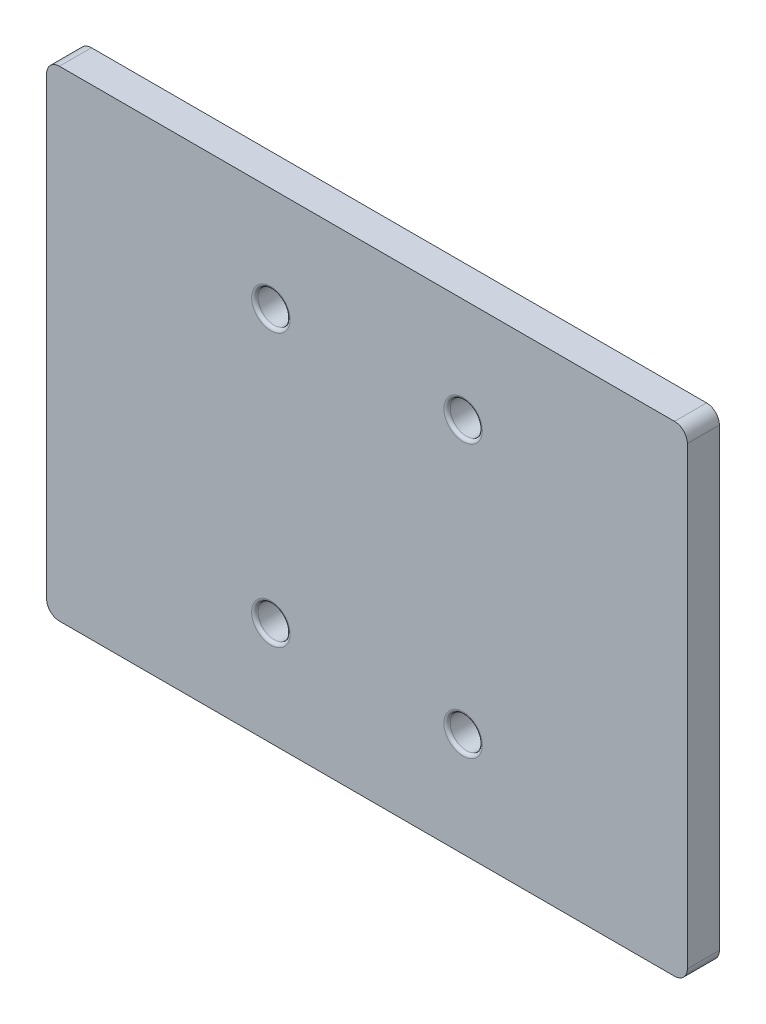
from build123d import *

# Parameters (mm, degrees)
STOCK_MASTER_BODY_001_1_START     = 1862
STOCK_MASTER_BODY_001_1_OUTLINE_W = 100
STOCK_MASTER_BODY_001_1_OUTLINE_H = 75
STOCK_MASTER_BODY_001_1_OUTLINE_R = 2.5
STOCK_MASTER_BODY_001_1_DEPTH     = 5
FILLET1_R                         = 2
FILLET2_R                         = 0.5


# Read off the part's stored shape, not the designer's step: Stock-master_body_001-1
with BuildPart() as part:
    # Stock-master_body_001-1 outline → Stock-master_body_001-1 (new body)
    with BuildSketch(Plane.XY.offset(STOCK_MASTER_BODY_001_1_START)):
        with Locations((200, 122.5)):
            Rectangle(STOCK_MASTER_BODY_001_1_OUTLINE_W, STOCK_MASTER_BODY_001_1_OUTLINE_H)
        with Locations((185, 101.25)):
            Circle(STOCK_MASTER_BODY_001_1_OUTLINE_R, mode=Mode.SUBTRACT)
        with Locations((215, 101.25)):
            Circle(STOCK_MASTER_BODY_001_1_OUTLINE_R, mode=Mode.SUBTRACT)
        with Locations((185, 143.75)):
            Circle(STOCK_MASTER_BODY_001_1_OUTLINE_R, mode=Mode.SUBTRACT)
        with Locations((215, 143.75)):
            Circle(STOCK_MASTER_BODY_001_1_OUTLINE_R, mode=Mode.SUBTRACT)
    extrude(amount=STOCK_MASTER_BODY_001_1_DEPTH)

    # Fillet1
    fillet1_edges = [part.edges().sort_by_distance(p)[0] for p in [
        (250, 85, 1864.5),
        (150, 85, 1864.5),
        (150, 160, 1864.5),
        (250, 160, 1864.5),
    ]]
    fillet(fillet1_edges, radius=FILLET1_R)

    # Fillet2
    fillet2_edges = [part.edges().sort_by_distance(p)[0] for p in [
        (212.5, 143.75, 1862),
        (212.5, 143.75, 1867),
        (182.5, 143.75, 1862),
        (182.5, 143.75, 1867),
        (182.5, 101.25, 1862),
        (182.5, 101.25, 1867),
        (212.5, 101.25, 1862),
        (212.5, 101.25, 1867),
    ]]
    fillet(fillet2_edges, radius=FILLET2_R)


solid = part.part
